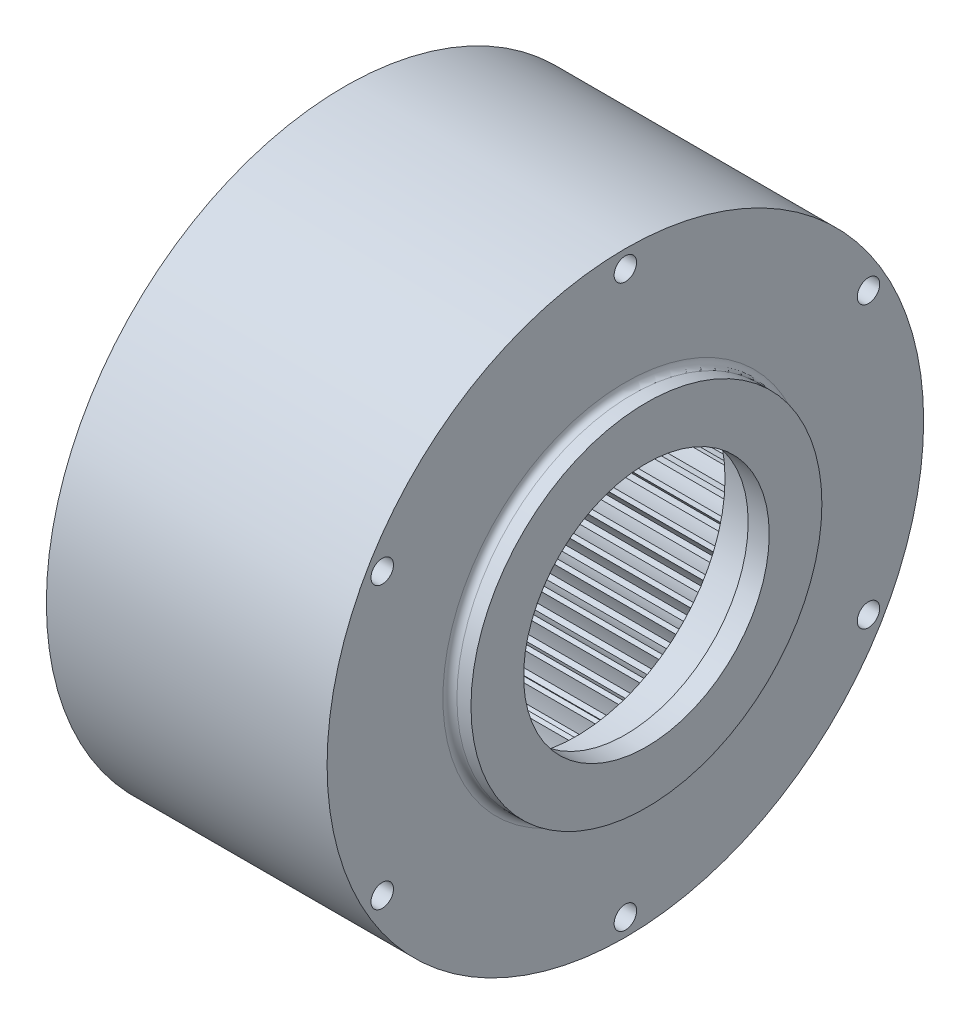
from build123d import *

# Parameters (mm, degrees)
BASPROSKE_W         = 30
BASPROSKE_H         = 8.5
TOOTHCUT_DEPTH      = 68.175144213
TEETHCUTS_COUNT     = 70
TEETHCUTS_ANGLE     = 354.857142857
BOSS_EXTRUDE1_START = 7
SKETCH1_R           = 42.5
SKETCH1_R_2         = 21.2
BOSS_EXTRUDE1_DEPTH = 7
SKETCH2_R           = 24.999999999
SKETCH2_R_2         = 17.499999999
BOSS_EXTRUDE2_DEPTH = 3
FILLET1_R           = 1
SKETCH4_R           = 42.5
BOSS_EXTRUDE3_DEPTH = 3
SKETCH6_R           = 1.6
CUT_EXTRUDE2_DEPTH  = 74.901962085


with BuildPart() as part:
    # BasProSke → Base-Revolve (revolve)
    with BuildSketch(Plane(origin=(0, 0, 0), x_dir=(1, 0, 0), z_dir=(0, 1, 0))):
        with Locations((15, 38.25)):
            Rectangle(BASPROSKE_W, BASPROSKE_H)
    revolve(axis=Axis((-10, 0, 0), (1, 0, 0)))

    # TooCutSke → ToothCut (cut, through all)
    with BuildSketch(Plane(origin=(0, 0, 0), x_dir=(0, 0, -1), z_dir=(1, 0, 0))):
        with BuildLine():
            ThreePointArc((1.226311931, 33.952460945), (0.832867774, 35.11607546), (0.358768615, 36.249224627))
            ThreePointArc((0.358768615, 36.249224627), (0, 36.251), (-0.358768615, 36.249224627))
            ThreePointArc((-0.358768615, 36.249224627), (-0.832867774, 35.11607546), (-1.226311931, 33.952460945))
            ThreePointArc((-1.226311931, 33.952460945), (0, 33.9746), (1.226311931, 33.952460945))
        make_face()
    toothcut = extrude(amount=TOOTHCUT_DEPTH, mode=Mode.SUBTRACT)

    # TeethCuts: ToothCut ×70 about axis
    teethcuts_axis = Axis((-10, 0, 0), (1, 0, 0))
    for i in range(1, TEETHCUTS_COUNT):
        add(toothcut.rotate(teethcuts_axis, i * TEETHCUTS_ANGLE / (TEETHCUTS_COUNT - 1)), mode=Mode.SUBTRACT)

    # Sketch1 → Boss-Extrude1 (add)
    with BuildSketch(Plane(origin=(30, 0, 0), x_dir=(0, 0, -1), z_dir=(1, 0, 0)).offset(BOSS_EXTRUDE1_START)):
        Circle(SKETCH1_R)
        Circle(SKETCH1_R_2, mode=Mode.SUBTRACT)
    extrude(amount=-BOSS_EXTRUDE1_DEPTH)

    # Sketch2 → Boss-Extrude2 (add)
    with BuildSketch(Plane(origin=(37, 0, 0), x_dir=(0, 0, -1), z_dir=(1, 0, 0))):
        with Locations((4e-09, -9e-09)):
            Circle(SKETCH2_R)
        with Locations((4e-09, -9e-09)):
            Circle(SKETCH2_R_2, mode=Mode.SUBTRACT)
    extrude(amount=BOSS_EXTRUDE2_DEPTH)

    # Fillet1
    fillet1_edges = [part.edges().sort_by_distance(p)[0] for p in [
        (37, -9e-09, 24.999999995),
    ]]
    fillet(fillet1_edges, radius=FILLET1_R)

    # Sketch4 → Boss-Extrude3 (add)
    with BuildSketch(Plane.ZY):
        Circle(SKETCH4_R)
        with BuildLine():
            ThreePointArc((-21.59700955, 29.115359855), (-21.307803181, 29.327675063), (-21.016509736, 29.537117657))
            ThreePointArc((-21.016509736, 29.537117657), (-19.978120328, 28.906410813), (-18.985993298, 28.205177867))
            ThreePointArc((-18.985993298, 28.205177867), (-18.730497369, 28.375490627), (-18.473473761, 28.543489051))
            ThreePointArc((-18.473473761, 28.543489051), (-18.728346173, 29.731379509), (-18.900185603, 30.934090987))
            ThreePointArc((-18.900185603, 30.934090987), (-18.593111705, 31.119627217), (-18.284216633, 31.302115314))
            ThreePointArc((-18.284216633, 31.302115314), (-17.3065436, 30.580867001), (-16.381268619, 29.793523431))
            ThreePointArc((-16.381268619, 29.793523431), (-16.111534524, 29.940248083), (-15.840486355, 30.084530776))
            ThreePointArc((-15.840486355, 30.084530776), (-15.987851045, 31.290485724), (-16.051188474, 32.503759007))
            ThreePointArc((-16.051188474, 32.503759007), (-15.728719427, 32.66102243), (-15.404709768, 32.815086743))
            ThreePointArc((-15.404709768, 32.815086743), (-14.49562476, 32.009104028), (-13.644651597, 31.141989063))
            ThreePointArc((-13.644651597, 31.141989063), (-13.362851076, 31.263944267), (-13.079960666, 31.38334955))
            ThreePointArc((-13.079960666, 31.38334955), (-13.118631142, 32.597659346), (-13.072956614, 33.811725871))
            ThreePointArc((-13.072956614, 33.811725871), (-12.737688748, 33.939450296), (-12.401173239, 34.063850389))
            ThreePointArc((-12.401173239, 34.063850389), (-11.567995673, 33.179622572), (-10.798175864, 32.23971771))
            ThreePointArc((-10.798175864, 32.23971771), (-10.506577809, 32.335921554), (-10.214122826, 32.429488046))
            ThreePointArc((-10.214122826, 32.429488046), (-10.143787734, 33.642375783), (-9.989468995, 34.847460599))
            ThreePointArc((-9.989468995, 34.847460599), (-9.644101689, 34.944617663), (-9.297789754, 35.03835194))
            ThreePointArc((-9.297789754, 35.03835194), (-8.547227886, 34.082998304), (-7.864759568, 33.077871106))
            ThreePointArc((-7.864759568, 33.077871106), (-7.565711755, 33.147549014), (-7.266046873, 33.214523372))
            ThreePointArc((-7.266046873, 33.214523372), (-7.087272512, 34.416223591), (-6.825552044, 35.602624065))
            ThreePointArc((-6.825552044, 35.602624065), (-6.472865993, 35.668431516), (-6.119545932, 35.730745284))
            ThreePointArc((-6.119545932, 35.730745284), (-5.457642846, 34.711957773), (-4.868020852, 33.649700935))
            ThreePointArc((-4.868020852, 33.649700935), (-4.563931038, 33.6922919), (-4.259468984, 33.732134886))
            ThreePointArc((-4.259468984, 33.732134886), (-3.973694739, 34.912972203), (-3.606679762, 36.071136135))
            ThreePointArc((-3.606679762, 36.071136135), (-3.249514587, 36.105064132), (-2.892031126, 36.135455677))
            ThreePointArc((-2.892031126, 36.135455677), (-2.324116075, 35.06143697), (-1.832087695, 33.950603156))
            ThreePointArc((-1.832087695, 33.950603156), (-1.525404232, 33.965764262), (-1.218596355, 33.978155084))
            ThreePointArc((-1.218596355, 33.978155084), (-0.828123112, 35.128622091), (-0.358768615, 36.249224627))
            ThreePointArc((-0.358768615, 36.249224627), (0, 36.251), (0.358768615, 36.249224627))
            ThreePointArc((0.358768615, 36.249224627), (0.828123112, 35.128622091), (1.218596355, 33.978155084))
            ThreePointArc((1.218596355, 33.978155084), (1.525404232, 33.965764262), (1.832087695, 33.950603156))
            ThreePointArc((1.832087695, 33.950603156), (2.324116075, 35.06143697), (2.892031126, 36.135455677))
            ThreePointArc((2.892031126, 36.135455677), (3.249514587, 36.105064132), (3.606679762, 36.071136135))
            ThreePointArc((3.606679762, 36.071136135), (3.973694739, 34.912972203), (4.259468984, 33.732134886))
            ThreePointArc((4.259468984, 33.732134886), (4.563931038, 33.6922919), (4.868020852, 33.649700935))
            ThreePointArc((4.868020852, 33.649700935), (5.457642846, 34.711957773), (6.119545932, 35.730745284))
            ThreePointArc((6.119545932, 35.730745284), (6.472865993, 35.668431516), (6.825552044, 35.602624065))
            ThreePointArc((6.825552044, 35.602624065), (7.087272512, 34.416223591), (7.266046873, 33.214523372))
            ThreePointArc((7.266046873, 33.214523372), (7.565711755, 33.147549014), (7.864759568, 33.077871106))
            ThreePointArc((7.864759568, 33.077871106), (8.547227886, 34.082998304), (9.297789754, 35.03835194))
            ThreePointArc((9.297789754, 35.03835194), (9.644101689, 34.944617663), (9.989468995, 34.847460599))
            ThreePointArc((9.989468995, 34.847460599), (10.143787734, 33.642375783), (10.214122826, 32.429488046))
            ThreePointArc((10.214122826, 32.429488046), (10.506577809, 32.335921554), (10.798175864, 32.23971771))
            ThreePointArc((10.798175864, 32.23971771), (11.567995673, 33.179622572), (12.401173239, 34.063850389))
            ThreePointArc((12.401173239, 34.063850389), (12.737688748, 33.939450296), (13.072956614, 33.811725871))
            ThreePointArc((13.072956614, 33.811725871), (13.118631142, 32.597659346), (13.079960666, 31.38334955))
            ThreePointArc((13.079960666, 31.38334955), (13.362851076, 31.263944267), (13.644651597, 31.141989063))
            ThreePointArc((13.644651597, 31.141989063), (14.49562476, 32.009104028), (15.404709768, 32.815086743))
            ThreePointArc((15.404709768, 32.815086743), (15.728719427, 32.66102243), (16.051188474, 32.503759007))
            ThreePointArc((16.051188474, 32.503759007), (15.987851045, 31.290485724), (15.840486355, 30.084530776))
            ThreePointArc((15.840486355, 30.084530776), (16.111534524, 29.940248083), (16.381268619, 29.793523431))
            ThreePointArc((16.381268619, 29.793523431), (17.306543601, 30.580867001), (18.284216633, 31.302115314))
            ThreePointArc((18.284216633, 31.302115314), (18.593111705, 31.119627217), (18.900185603, 30.934090987))
            ThreePointArc((18.900185603, 30.934090987), (18.728346173, 29.731379509), (18.473473761, 28.543489051))
            ThreePointArc((18.473473761, 28.543489051), (18.730497369, 28.375490627), (18.985993298, 28.205177867))
            ThreePointArc((18.985993298, 28.205177867), (19.978120328, 28.906410813), (21.016509736, 29.537117657))
            ThreePointArc((21.016509736, 29.537117657), (21.307803181, 29.327675063), (21.59700955, 29.115359855))
            ThreePointArc((21.59700955, 29.115359855), (21.318051669, 27.932893708), (20.957723619, 26.772631934))
            ThreePointArc((20.957723619, 26.772631934), (21.198653263, 26.582270404), (21.437853922, 26.389740795))
            ThreePointArc((21.437853922, 26.389740795), (22.488844977, 26.999217202), (23.579590261, 27.534304497))
            ThreePointArc((23.579590261, 27.534304497), (23.850936754, 27.299593714), (24.119947075, 27.062208966))
            ThreePointArc((24.119947075, 27.062208966), (23.736116748, 25.909508672), (23.27323421, 24.786217328))
            ThreePointArc((23.27323421, 24.786217328), (23.496130066, 24.57502537), (23.717109552, 24.361829047))
            ThreePointArc((23.717109552, 24.361829047), (24.818502669, 24.874641769), (25.952821789, 25.309801307))
            ThreePointArc((25.952821789, 25.309801307), (26.202036609, 25.051712088), (26.448684968, 24.791169082))
            ThreePointArc((26.448684968, 24.791169082), (25.963072572, 23.677515506), (25.401362403, 22.600238673))
            ThreePointArc((25.401362403, 22.600238673), (25.604429844, 22.369916682), (25.805408961, 22.137770176))
            ThreePointArc((25.805408961, 22.137770176), (26.948336372, 22.549790347), (28.117096456, 22.881518479))
            ThreePointArc((28.117096456, 22.881518479), (28.342173071, 22.602128807), (28.564473601, 22.320525282))
            ThreePointArc((28.564473601, 22.320525282), (27.980989001, 21.254884907), (27.324973761, 20.232296186))
            ThreePointArc((27.324973761, 20.232296186), (27.506577809, 19.984698578), (27.68593839, 19.735470996))
            ThreePointArc((27.68593839, 19.735470996), (28.861197915, 20.043381272), (30.054988795, 20.269007118))
            ThreePointArc((30.054988795, 20.269007118), (30.254115021, 19.970566475), (30.450277889, 19.670169737))
            ThreePointArc((30.450277889, 19.670169737), (29.77361896, 18.661122473), (29.028580498, 17.701455146))
            ThreePointArc((29.028580498, 17.701455146), (29.187258982, 17.438575432), (29.343556923, 17.174273409))
            ThreePointArc((29.343556923, 17.174273409), (30.541686062, 17.375594677), (31.750896036, 17.493301629))
            ThreePointArc((31.750896036, 17.493301629), (31.922468625, 17.178212883), (32.090914444, 16.86144155))
            ThreePointArc((32.090914444, 16.86144155), (31.326529245, 15.917111653), (30.498466173, 15.028092397))
            ThreePointArc((30.498466173, 15.028092397), (30.632941509, 14.75204713), (30.764918389, 14.47479867))
            ThreePointArc((30.764918389, 14.47479867), (31.976270512, 14.56791001), (33.191163732, 14.576750362))
            ThreePointArc((33.191163732, 14.576750362), (33.333801283, 14.247550422), (33.473173825, 13.916954951))
            ThreePointArc((33.473173825, 13.916954951), (32.627216736, 13.044945609), (31.722796131, 12.233732285))
            ThreePointArc((31.722796131, 12.233732285), (31.831985602, 11.946744019), (31.938578821, 11.658781363))
            ThreePointArc((31.938578821, 11.658781363), (33.153400833, 11.642933097), (34.364195693, 11.542835672))
            ThreePointArc((34.364195693, 11.542835672), (34.476749772, 11.202175063), (34.585926892, 10.860417214))
            ThreePointArc((34.585926892, 10.860417214), (33.665209063, 10.067749333), (32.691712788, 9.340873354))
            ThreePointArc((32.691712788, 9.340873354), (32.774737264, 9.045252749), (32.855088597, 8.748894404))
            ThreePointArc((32.855088597, 8.748894404), (34.063599465, 8.624214133), (35.260547357, 8.415984856))
            ThreePointArc((35.260547357, 8.415984856), (35.342111745, 8.066606377), (35.420214411, 7.716437782))
            ThreePointArc((35.420214411, 7.716437782), (34.432148921, 7.00949346), (33.397414995, 6.372807203))
            ThreePointArc((33.397414995, 6.372807203), (33.453606012, 6.070934423), (33.507068517, 5.768566492))
            ThreePointArc((33.507068517, 5.768566492), (34.699538023, 5.536058067), (35.873001826, 5.221373479))
            ThreePointArc((35.873001826, 5.221373479), (35.922919814, 4.866090119), (35.969319192, 4.510330131))
            ThreePointArc((35.969319192, 4.510330131), (34.921861362, 3.894801267), (33.834220854, 3.353430955))
            ThreePointArc((33.834220854, 3.353430955), (33.863125996, 3.047736503), (33.889269224, 2.741793473))
            ThreePointArc((33.889269224, 2.741793473), (35.056096303, 2.403328917), (36.196627977, 1.984722672))
            ThreePointArc((36.196627977, 1.984722672), (36.214497655, 1.626394965), (36.228820163, 1.267907954))
            ThreePointArc((36.228820163, 1.267907954), (35.130403509, 0.748750424), (33.998613462, 0.307054853))
            ThreePointArc((33.998613462, 0.307054853), (34, 0), (33.998613462, -0.307054853))
            ThreePointArc((33.998613462, -0.307054853), (35.130403509, -0.748750424), (36.228820163, -1.267907954))
            ThreePointArc((36.228820163, -1.267907954), (36.214497655, -1.626394965), (36.196627977, -1.984722672))
            ThreePointArc((36.196627977, -1.984722672), (35.056096303, -2.403328917), (33.889269224, -2.741793473))
            ThreePointArc((33.889269224, -2.741793473), (33.863125996, -3.047736503), (33.834220854, -3.353430955))
            ThreePointArc((33.834220854, -3.353430955), (34.921861362, -3.894801267), (35.969319192, -4.510330131))
            ThreePointArc((35.969319192, -4.510330131), (35.922919814, -4.866090119), (35.873001826, -5.221373479))
            ThreePointArc((35.873001826, -5.221373479), (34.699538023, -5.536058067), (33.507068517, -5.768566492))
            ThreePointArc((33.507068517, -5.768566492), (33.453606012, -6.070934423), (33.397414995, -6.372807203))
            ThreePointArc((33.397414995, -6.372807203), (34.432148921, -7.00949346), (35.420214411, -7.716437782))
            ThreePointArc((35.420214411, -7.716437782), (35.342111745, -8.066606377), (35.260547357, -8.415984856))
            ThreePointArc((35.260547357, -8.415984856), (34.063599465, -8.624214133), (32.855088597, -8.748894404))
            ThreePointArc((32.855088597, -8.748894404), (32.774737264, -9.045252749), (32.691712788, -9.340873354))
            ThreePointArc((32.691712788, -9.340873354), (33.665209063, -10.067749333), (34.585926892, -10.860417214))
            ThreePointArc((34.585926892, -10.860417214), (34.476749772, -11.202175063), (34.364195693, -11.542835672))
            ThreePointArc((34.364195693, -11.542835672), (33.153400833, -11.642933097), (31.938578821, -11.658781363))
            ThreePointArc((31.938578821, -11.658781363), (31.831985602, -11.946744019), (31.722796131, -12.233732285))
            ThreePointArc((31.722796131, -12.233732285), (32.627216736, -13.044945609), (33.473173825, -13.916954951))
            ThreePointArc((33.473173825, -13.916954951), (33.333801283, -14.247550422), (33.191163732, -14.576750362))
            ThreePointArc((33.191163732, -14.576750362), (31.976270512, -14.56791001), (30.764918389, -14.47479867))
            ThreePointArc((30.764918389, -14.47479867), (30.632941509, -14.75204713), (30.498466173, -15.028092397))
            ThreePointArc((30.498466173, -15.028092397), (31.326529245, -15.917111653), (32.090914444, -16.86144155))
            ThreePointArc((32.090914444, -16.86144155), (31.922468625, -17.178212883), (31.750896036, -17.493301629))
            ThreePointArc((31.750896036, -17.493301629), (30.541686062, -17.375594677), (29.343556923, -17.174273409))
            ThreePointArc((29.343556923, -17.174273409), (29.187258982, -17.438575432), (29.028580498, -17.701455146))
            ThreePointArc((29.028580498, -17.701455146), (29.77361896, -18.661122473), (30.450277889, -19.670169737))
            ThreePointArc((30.450277889, -19.670169737), (30.254115021, -19.970566475), (30.054988795, -20.269007118))
            ThreePointArc((30.054988795, -20.269007118), (28.861197915, -20.043381272), (27.68593839, -19.735470997))
            ThreePointArc((27.68593839, -19.735470997), (27.506577809, -19.984698578), (27.324973761, -20.232296186))
            ThreePointArc((27.324973761, -20.232296186), (27.980989001, -21.254884907), (28.564473601, -22.320525282))
            ThreePointArc((28.564473601, -22.320525282), (28.342173071, -22.602128807), (28.117096456, -22.881518479))
            ThreePointArc((28.117096456, -22.881518479), (26.948336372, -22.549790347), (25.805408961, -22.137770176))
            ThreePointArc((25.805408961, -22.137770176), (25.604429844, -22.369916682), (25.401362403, -22.600238673))
            ThreePointArc((25.401362403, -22.600238673), (25.963072572, -23.677515506), (26.448684968, -24.791169082))
            ThreePointArc((26.448684968, -24.791169082), (26.202036609, -25.051712088), (25.952821789, -25.309801307))
            ThreePointArc((25.952821789, -25.309801307), (24.818502669, -24.874641769), (23.717109552, -24.361829047))
            ThreePointArc((23.717109552, -24.361829047), (23.496130066, -24.57502537), (23.27323421, -24.786217328))
            ThreePointArc((23.27323421, -24.786217328), (23.736116748, -25.909508672), (24.119947075, -27.062208966))
            ThreePointArc((24.119947075, -27.062208966), (23.850936754, -27.299593714), (23.579590261, -27.534304497))
            ThreePointArc((23.579590261, -27.534304497), (22.488844977, -26.999217202), (21.437853922, -26.389740795))
            ThreePointArc((21.437853922, -26.389740795), (21.198653263, -26.582270404), (20.957723619, -26.772631934))
            ThreePointArc((20.957723619, -26.772631934), (21.318051669, -27.932893708), (21.59700955, -29.115359855))
            ThreePointArc((21.59700955, -29.115359855), (21.307803181, -29.327675063), (21.016509736, -29.537117657))
            ThreePointArc((21.016509736, -29.537117657), (19.978120328, -28.906410813), (18.985993298, -28.205177867))
            ThreePointArc((18.985993298, -28.205177867), (18.730497369, -28.375490627), (18.473473761, -28.543489051))
            ThreePointArc((18.473473761, -28.543489051), (18.728346173, -29.731379509), (18.900185603, -30.934090987))
            ThreePointArc((18.900185603, -30.934090987), (18.593111705, -31.119627217), (18.284216633, -31.302115314))
            ThreePointArc((18.284216633, -31.302115314), (17.306543601, -30.580867001), (16.381268619, -29.793523431))
            ThreePointArc((16.381268619, -29.793523431), (16.111534524, -29.940248083), (15.840486355, -30.084530776))
            ThreePointArc((15.840486355, -30.084530776), (15.987851045, -31.290485724), (16.051188474, -32.503759007))
            ThreePointArc((16.051188474, -32.503759007), (15.728719427, -32.66102243), (15.404709768, -32.815086743))
            ThreePointArc((15.404709768, -32.815086743), (14.49562476, -32.009104028), (13.644651597, -31.141989063))
            ThreePointArc((13.644651597, -31.141989063), (13.362851076, -31.263944267), (13.079960666, -31.38334955))
            ThreePointArc((13.079960666, -31.38334955), (13.118631142, -32.597659346), (13.072956614, -33.811725871))
            ThreePointArc((13.072956614, -33.811725871), (12.737688748, -33.939450296), (12.401173239, -34.063850389))
            ThreePointArc((12.401173239, -34.063850389), (11.567995673, -33.179622572), (10.798175864, -32.23971771))
            ThreePointArc((10.798175864, -32.23971771), (10.506577809, -32.335921554), (10.214122826, -32.429488046))
            ThreePointArc((10.214122826, -32.429488046), (10.143787734, -33.642375783), (9.989468995, -34.847460599))
            ThreePointArc((9.989468995, -34.847460599), (9.644101689, -34.944617663), (9.297789754, -35.03835194))
            ThreePointArc((9.297789754, -35.03835194), (8.547227886, -34.082998304), (7.864759568, -33.077871107))
            ThreePointArc((7.864759568, -33.077871107), (7.565711755, -33.147549014), (7.266046873, -33.214523372))
            ThreePointArc((7.266046873, -33.214523372), (7.087272512, -34.416223591), (6.825552044, -35.602624065))
            ThreePointArc((6.825552044, -35.602624065), (6.472865993, -35.668431516), (6.119545932, -35.730745284))
            ThreePointArc((6.119545932, -35.730745284), (5.457642846, -34.711957773), (4.868020852, -33.649700935))
            ThreePointArc((4.868020852, -33.649700935), (4.563931038, -33.6922919), (4.259468984, -33.732134886))
            ThreePointArc((4.259468984, -33.732134886), (3.973694739, -34.912972203), (3.606679762, -36.071136135))
            ThreePointArc((3.606679762, -36.071136135), (3.249514587, -36.105064132), (2.892031126, -36.135455677))
            ThreePointArc((2.892031126, -36.135455677), (2.324116075, -35.06143697), (1.832087695, -33.950603156))
            ThreePointArc((1.832087695, -33.950603156), (1.525404232, -33.965764262), (1.218596355, -33.978155084))
            ThreePointArc((1.218596355, -33.978155084), (0.828123112, -35.128622091), (0.358768615, -36.249224627))
            ThreePointArc((0.358768615, -36.249224627), (0, -36.251), (-0.358768615, -36.249224627))
            ThreePointArc((-0.358768615, -36.249224627), (-0.828123112, -35.128622091), (-1.218596355, -33.978155084))
            ThreePointArc((-1.218596355, -33.978155084), (-1.525404232, -33.965764262), (-1.832087695, -33.950603156))
            ThreePointArc((-1.832087695, -33.950603156), (-2.324116075, -35.06143697), (-2.892031126, -36.135455677))
            ThreePointArc((-2.892031126, -36.135455677), (-3.249514587, -36.105064132), (-3.606679762, -36.071136135))
            ThreePointArc((-3.606679762, -36.071136135), (-3.973694739, -34.912972203), (-4.259468984, -33.732134886))
            ThreePointArc((-4.259468984, -33.732134886), (-4.563931038, -33.6922919), (-4.868020852, -33.649700935))
            ThreePointArc((-4.868020852, -33.649700935), (-5.457642846, -34.711957773), (-6.119545932, -35.730745284))
            ThreePointArc((-6.119545932, -35.730745284), (-6.472865993, -35.668431516), (-6.825552044, -35.602624065))
            ThreePointArc((-6.825552044, -35.602624065), (-7.087272512, -34.416223591), (-7.266046873, -33.214523372))
            ThreePointArc((-7.266046873, -33.214523372), (-7.565711755, -33.147549014), (-7.864759568, -33.077871107))
            ThreePointArc((-7.864759568, -33.077871107), (-8.547227886, -34.082998304), (-9.297789754, -35.03835194))
            ThreePointArc((-9.297789754, -35.03835194), (-9.644101689, -34.944617663), (-9.989468995, -34.847460599))
            ThreePointArc((-9.989468995, -34.847460599), (-10.143787734, -33.642375783), (-10.214122826, -32.429488046))
            ThreePointArc((-10.214122826, -32.429488046), (-10.506577809, -32.335921554), (-10.798175864, -32.23971771))
            ThreePointArc((-10.798175864, -32.23971771), (-11.567995673, -33.179622572), (-12.401173239, -34.063850389))
            ThreePointArc((-12.401173239, -34.063850389), (-12.737688748, -33.939450296), (-13.072956614, -33.811725871))
            ThreePointArc((-13.072956614, -33.811725871), (-13.118631142, -32.597659346), (-13.079960666, -31.38334955))
            ThreePointArc((-13.079960666, -31.38334955), (-13.362851076, -31.263944267), (-13.644651597, -31.141989063))
            ThreePointArc((-13.644651597, -31.141989063), (-14.49562476, -32.009104028), (-15.404709768, -32.815086743))
            ThreePointArc((-15.404709768, -32.815086743), (-15.728719427, -32.66102243), (-16.051188474, -32.503759007))
            ThreePointArc((-16.051188474, -32.503759007), (-15.987851045, -31.290485724), (-15.840486355, -30.084530776))
            ThreePointArc((-15.840486355, -30.084530776), (-16.111534524, -29.940248083), (-16.381268619, -29.793523431))
            ThreePointArc((-16.381268619, -29.793523431), (-17.3065436, -30.580867001), (-18.284216633, -31.302115314))
            ThreePointArc((-18.284216633, -31.302115314), (-18.593111705, -31.119627217), (-18.900185603, -30.934090987))
            ThreePointArc((-18.900185603, -30.934090987), (-18.728346173, -29.731379509), (-18.473473761, -28.543489051))
            ThreePointArc((-18.473473761, -28.543489051), (-18.730497369, -28.375490627), (-18.985993298, -28.205177867))
            ThreePointArc((-18.985993298, -28.205177867), (-19.978120328, -28.906410813), (-21.016509736, -29.537117657))
            ThreePointArc((-21.016509736, -29.537117657), (-21.307803181, -29.327675063), (-21.59700955, -29.115359855))
            ThreePointArc((-21.59700955, -29.115359855), (-21.318051669, -27.932893708), (-20.957723619, -26.772631934))
            ThreePointArc((-20.957723619, -26.772631934), (-21.198653263, -26.582270404), (-21.437853922, -26.389740795))
            ThreePointArc((-21.437853922, -26.389740795), (-22.488844977, -26.999217202), (-23.579590261, -27.534304497))
            ThreePointArc((-23.579590261, -27.534304497), (-23.850936754, -27.299593714), (-24.119947075, -27.062208966))
            ThreePointArc((-24.119947075, -27.062208966), (-23.736116748, -25.909508672), (-23.27323421, -24.786217328))
            ThreePointArc((-23.27323421, -24.786217328), (-23.496130066, -24.57502537), (-23.717109552, -24.361829047))
            ThreePointArc((-23.717109552, -24.361829047), (-24.818502669, -24.874641769), (-25.952821789, -25.309801307))
            ThreePointArc((-25.952821789, -25.309801307), (-26.202036609, -25.051712088), (-26.448684968, -24.791169082))
            ThreePointArc((-26.448684968, -24.791169082), (-25.963072572, -23.677515506), (-25.401362403, -22.600238673))
            ThreePointArc((-25.401362403, -22.600238673), (-25.604429844, -22.369916682), (-25.805408961, -22.137770176))
            ThreePointArc((-25.805408961, -22.137770176), (-26.948336372, -22.549790347), (-28.117096456, -22.881518479))
            ThreePointArc((-28.117096456, -22.881518479), (-28.342173071, -22.602128807), (-28.564473601, -22.320525282))
            ThreePointArc((-28.564473601, -22.320525282), (-27.980989001, -21.254884907), (-27.324973761, -20.232296186))
            ThreePointArc((-27.324973761, -20.232296186), (-27.506577809, -19.984698578), (-27.68593839, -19.735470996))
            ThreePointArc((-27.68593839, -19.735470996), (-28.861197915, -20.043381272), (-30.054988795, -20.269007118))
            ThreePointArc((-30.054988795, -20.269007118), (-30.254115021, -19.970566475), (-30.450277889, -19.670169737))
            ThreePointArc((-30.450277889, -19.670169737), (-29.77361896, -18.661122473), (-29.028580498, -17.701455146))
            ThreePointArc((-29.028580498, -17.701455146), (-29.187258982, -17.438575432), (-29.343556923, -17.174273409))
            ThreePointArc((-29.343556923, -17.174273409), (-30.541686062, -17.375594677), (-31.750896036, -17.493301629))
            ThreePointArc((-31.750896036, -17.493301629), (-31.922468625, -17.178212883), (-32.090914444, -16.86144155))
            ThreePointArc((-32.090914444, -16.86144155), (-31.326529245, -15.917111653), (-30.498466173, -15.028092397))
            ThreePointArc((-30.498466173, -15.028092397), (-30.632941509, -14.75204713), (-30.764918389, -14.47479867))
            ThreePointArc((-30.764918389, -14.47479867), (-31.976270512, -14.56791001), (-33.191163732, -14.576750362))
            ThreePointArc((-33.191163732, -14.576750362), (-33.333801283, -14.247550422), (-33.473173825, -13.916954951))
            ThreePointArc((-33.473173825, -13.916954951), (-32.627216736, -13.044945609), (-31.722796131, -12.233732285))
            ThreePointArc((-31.722796131, -12.233732285), (-31.831985602, -11.946744019), (-31.938578821, -11.658781363))
            ThreePointArc((-31.938578821, -11.658781363), (-33.153400833, -11.642933097), (-34.364195693, -11.542835672))
            ThreePointArc((-34.364195693, -11.542835672), (-34.476749772, -11.202175063), (-34.585926892, -10.860417214))
            ThreePointArc((-34.585926892, -10.860417214), (-33.665209063, -10.067749333), (-32.691712788, -9.340873354))
            ThreePointArc((-32.691712788, -9.340873354), (-32.774737264, -9.045252749), (-32.855088597, -8.748894404))
            ThreePointArc((-32.855088597, -8.748894404), (-34.063599465, -8.624214133), (-35.260547357, -8.415984856))
            ThreePointArc((-35.260547357, -8.415984856), (-35.342111745, -8.066606377), (-35.420214411, -7.716437782))
            ThreePointArc((-35.420214411, -7.716437782), (-34.432148921, -7.00949346), (-33.397414995, -6.372807203))
            ThreePointArc((-33.397414995, -6.372807203), (-33.453606012, -6.070934423), (-33.507068517, -5.768566492))
            ThreePointArc((-33.507068517, -5.768566492), (-34.699538023, -5.536058067), (-35.873001826, -5.221373479))
            ThreePointArc((-35.873001826, -5.221373479), (-35.922919814, -4.866090119), (-35.969319192, -4.510330131))
            ThreePointArc((-35.969319192, -4.510330131), (-34.921861362, -3.894801267), (-33.834220854, -3.353430955))
            ThreePointArc((-33.834220854, -3.353430955), (-33.863125996, -3.047736503), (-33.889269224, -2.741793473))
            ThreePointArc((-33.889269224, -2.741793473), (-35.056096303, -2.403328917), (-36.196627977, -1.984722672))
            ThreePointArc((-36.196627977, -1.984722672), (-36.214497655, -1.626394965), (-36.228820163, -1.267907954))
            ThreePointArc((-36.228820163, -1.267907954), (-35.130403509, -0.748750424), (-33.998613462, -0.307054853))
            ThreePointArc((-33.998613462, -0.307054853), (-34, 0), (-33.998613462, 0.307054853))
            ThreePointArc((-33.998613462, 0.307054853), (-35.130403509, 0.748750424), (-36.228820163, 1.267907954))
            ThreePointArc((-36.228820163, 1.267907954), (-36.214497655, 1.626394965), (-36.196627977, 1.984722672))
            ThreePointArc((-36.196627977, 1.984722672), (-35.056096303, 2.403328917), (-33.889269224, 2.741793473))
            ThreePointArc((-33.889269224, 2.741793473), (-33.863125996, 3.047736503), (-33.834220854, 3.353430955))
            ThreePointArc((-33.834220854, 3.353430955), (-34.921861362, 3.894801267), (-35.969319192, 4.510330131))
            ThreePointArc((-35.969319192, 4.510330131), (-35.922919814, 4.866090119), (-35.873001826, 5.221373479))
            ThreePointArc((-35.873001826, 5.221373479), (-34.699538023, 5.536058067), (-33.507068517, 5.768566492))
            ThreePointArc((-33.507068517, 5.768566492), (-33.453606012, 6.070934423), (-33.397414995, 6.372807203))
            ThreePointArc((-33.397414995, 6.372807203), (-34.432148921, 7.00949346), (-35.420214411, 7.716437782))
            ThreePointArc((-35.420214411, 7.716437782), (-35.342111745, 8.066606377), (-35.260547357, 8.415984856))
            ThreePointArc((-35.260547357, 8.415984856), (-34.063599465, 8.624214133), (-32.855088597, 8.748894404))
            ThreePointArc((-32.855088597, 8.748894404), (-32.774737264, 9.045252749), (-32.691712788, 9.340873354))
            ThreePointArc((-32.691712788, 9.340873354), (-33.665209063, 10.067749333), (-34.585926892, 10.860417214))
            ThreePointArc((-34.585926892, 10.860417214), (-34.476749772, 11.202175063), (-34.364195693, 11.542835672))
            ThreePointArc((-34.364195693, 11.542835672), (-33.153400833, 11.642933097), (-31.938578821, 11.658781363))
            ThreePointArc((-31.938578821, 11.658781363), (-31.831985602, 11.946744019), (-31.722796131, 12.233732285))
            ThreePointArc((-31.722796131, 12.233732285), (-32.627216736, 13.044945609), (-33.473173825, 13.916954951))
            ThreePointArc((-33.473173825, 13.916954951), (-33.333801283, 14.247550422), (-33.191163732, 14.576750362))
            ThreePointArc((-33.191163732, 14.576750362), (-31.976270512, 14.56791001), (-30.764918389, 14.47479867))
            ThreePointArc((-30.764918389, 14.47479867), (-30.632941509, 14.75204713), (-30.498466173, 15.028092397))
            ThreePointArc((-30.498466173, 15.028092397), (-31.326529245, 15.917111653), (-32.090914444, 16.86144155))
            ThreePointArc((-32.090914444, 16.86144155), (-31.922468625, 17.178212883), (-31.750896036, 17.493301629))
            ThreePointArc((-31.750896036, 17.493301629), (-30.541686062, 17.375594677), (-29.343556923, 17.174273409))
            ThreePointArc((-29.343556923, 17.174273409), (-29.187258982, 17.438575432), (-29.028580498, 17.701455146))
            ThreePointArc((-29.028580498, 17.701455146), (-29.77361896, 18.661122473), (-30.450277889, 19.670169737))
            ThreePointArc((-30.450277889, 19.670169737), (-30.254115021, 19.970566475), (-30.054988795, 20.269007118))
            ThreePointArc((-30.054988795, 20.269007118), (-28.861197915, 20.043381272), (-27.68593839, 19.735470996))
            ThreePointArc((-27.68593839, 19.735470996), (-27.506577809, 19.984698578), (-27.324973761, 20.232296186))
            ThreePointArc((-27.324973761, 20.232296186), (-27.980989001, 21.254884907), (-28.564473601, 22.320525282))
            ThreePointArc((-28.564473601, 22.320525282), (-28.342173071, 22.602128807), (-28.117096456, 22.881518479))
            ThreePointArc((-28.117096456, 22.881518479), (-26.948336372, 22.549790347), (-25.805408961, 22.137770176))
            ThreePointArc((-25.805408961, 22.137770176), (-25.604429844, 22.369916682), (-25.401362403, 22.600238673))
            ThreePointArc((-25.401362403, 22.600238673), (-25.963072572, 23.677515506), (-26.448684968, 24.791169082))
            ThreePointArc((-26.448684968, 24.791169082), (-26.202036609, 25.051712088), (-25.952821789, 25.309801307))
            ThreePointArc((-25.952821789, 25.309801307), (-24.818502669, 24.874641769), (-23.717109552, 24.361829047))
            ThreePointArc((-23.717109552, 24.361829047), (-23.496130066, 24.57502537), (-23.27323421, 24.786217328))
            ThreePointArc((-23.27323421, 24.786217328), (-23.736116748, 25.909508672), (-24.119947075, 27.062208966))
            ThreePointArc((-24.119947075, 27.062208966), (-23.850936754, 27.299593714), (-23.579590261, 27.534304497))
            ThreePointArc((-23.579590261, 27.534304497), (-22.488844977, 26.999217202), (-21.437853922, 26.389740795))
            ThreePointArc((-21.437853922, 26.389740795), (-21.198653263, 26.582270404), (-20.957723619, 26.772631934))
            ThreePointArc((-20.957723619, 26.772631934), (-21.318051669, 27.932893708), (-21.59700955, 29.115359855))
        make_face(mode=Mode.SUBTRACT)
    extrude(amount=BOSS_EXTRUDE3_DEPTH)

    # Sketch6 → Cut-Extrude2 (cut, through all)
    with BuildSketch(Plane.ZY.offset(3)):
        with Locations((-34.641016143, 19.999999995)):
            Circle(SKETCH6_R)
        with Locations((0, 39.99999999)):
            Circle(SKETCH6_R)
        with Locations((34.641016143, 19.999999995)):
            Circle(SKETCH6_R)
        with Locations((34.641016143, -19.999999995)):
            Circle(SKETCH6_R)
        with Locations((0, -39.99999999)):
            Circle(SKETCH6_R)
        with Locations((-34.641016143, -19.999999995)):
            Circle(SKETCH6_R)
    extrude(amount=-CUT_EXTRUDE2_DEPTH, mode=Mode.SUBTRACT)


solid = part.part
